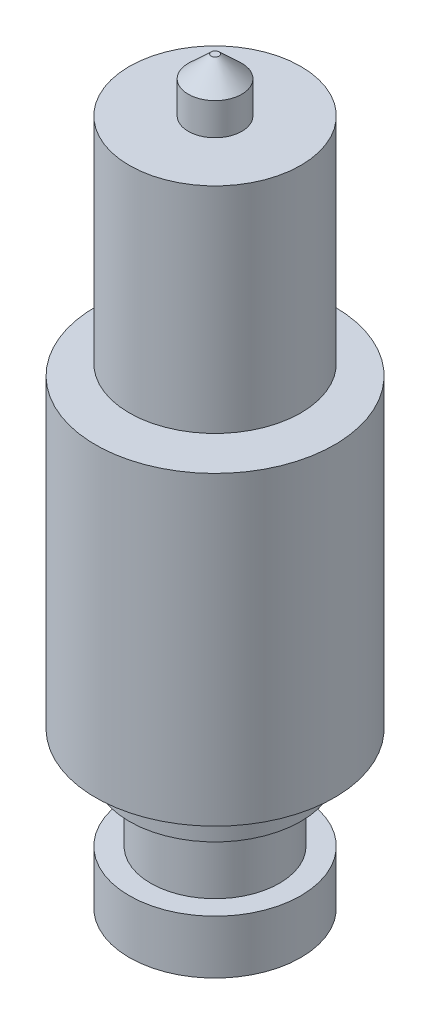
from build123d import *

# Parameters (mm, degrees)
SKETCH1_R           = 8
BOSS_EXTRUDE1_DEPTH = 5
SKETCH2_R           = 6
BOSS_EXTRUDE2_DEPTH = 6
SKETCH3_R           = 8
BOSS_EXTRUDE3_DEPTH = 1.5
SKETCH4_R           = 5
BOSS_EXTRUDE4_DEPTH = 2
SKETCH5_R           = 11.15
BOSS_EXTRUDE5_DEPTH = 28.5
SKETCH6_R           = 2
BOSS_EXTRUDE6_DEPTH = 1
SKETCH7_R           = 8
BOSS_EXTRUDE7_DEPTH = 20
SKETCH8_R           = 2.5
BOSS_EXTRUDE8_DEPTH = 3
SKETCH9_R           = 2.5
BOSS_EXTRUDE9_DEPTH = 2
BOSS_EXTRUDE9_TAPER = 47
SKETCH_1_R          = 1
CUT_EXTRUDE_1_DEPTH = 10


with BuildPart() as part:
    # Sketch1 → Boss-Extrude1 (new body)
    with BuildSketch(Plane(origin=(0, 0, 0), x_dir=(1, 0, 0), z_dir=(0, 1, 0))):
        Circle(SKETCH1_R)
    extrude(amount=BOSS_EXTRUDE1_DEPTH)

    # Sketch2 → Boss-Extrude2 (add)
    with BuildSketch(Plane(origin=(0, 5, 0), x_dir=(1, 0, 0), z_dir=(0, 1, 0))):
        Circle(SKETCH2_R)
    extrude(amount=BOSS_EXTRUDE2_DEPTH)

    # Sketch3 → Boss-Extrude3 (add)
    with BuildSketch(Plane(origin=(0, 11, 0), x_dir=(1, 0, 0), z_dir=(0, 1, 0))):
        Circle(SKETCH3_R)
    extrude(amount=BOSS_EXTRUDE3_DEPTH)

    # Sketch4 → Boss-Extrude4 (add)
    with BuildSketch(Plane(origin=(0, 12.5, 0), x_dir=(1, 0, 0), z_dir=(0, 1, 0))):
        Circle(SKETCH4_R)
    extrude(amount=BOSS_EXTRUDE4_DEPTH)

    # Sketch5 → Boss-Extrude5 (add)
    with BuildSketch(Plane(origin=(0, 14.5, 0), x_dir=(1, 0, 0), z_dir=(0, 1, 0))):
        Circle(SKETCH5_R)
    extrude(amount=BOSS_EXTRUDE5_DEPTH)

    # Sketch6 → Boss-Extrude6 (add)
    with BuildSketch(Plane(origin=(0, 43, 0), x_dir=(1, 0, 0), z_dir=(0, 1, 0))):
        Circle(SKETCH6_R)
    extrude(amount=BOSS_EXTRUDE6_DEPTH)

    # Sketch7 → Boss-Extrude7 (add)
    with BuildSketch(Plane(origin=(0, 44, 0), x_dir=(1, 0, 0), z_dir=(0, 1, 0))):
        Circle(SKETCH7_R)
    extrude(amount=BOSS_EXTRUDE7_DEPTH)

    # Sketch8 → Boss-Extrude8 (add)
    with BuildSketch(Plane(origin=(0, 64, 0), x_dir=(1, 0, 0), z_dir=(0, 1, 0))):
        Circle(SKETCH8_R)
    extrude(amount=BOSS_EXTRUDE8_DEPTH)

    # Sketch9 → Boss-Extrude9 (add)
    with BuildSketch(Plane(origin=(0, 67, 0), x_dir=(1, 0, 0), z_dir=(0, 1, 0))):
        Circle(SKETCH9_R)
    extrude(amount=BOSS_EXTRUDE9_DEPTH, taper=BOSS_EXTRUDE9_TAPER)

    # 草图1 → 切除-拉伸1 (cut)
    with BuildSketch(Plane(origin=(0, 0, 0), x_dir=(-1, 0, 0), z_dir=(0, -1, 0))):
        Circle(SKETCH_1_R)
    extrude(amount=-CUT_EXTRUDE_1_DEPTH, mode=Mode.SUBTRACT)


solid = part.part
